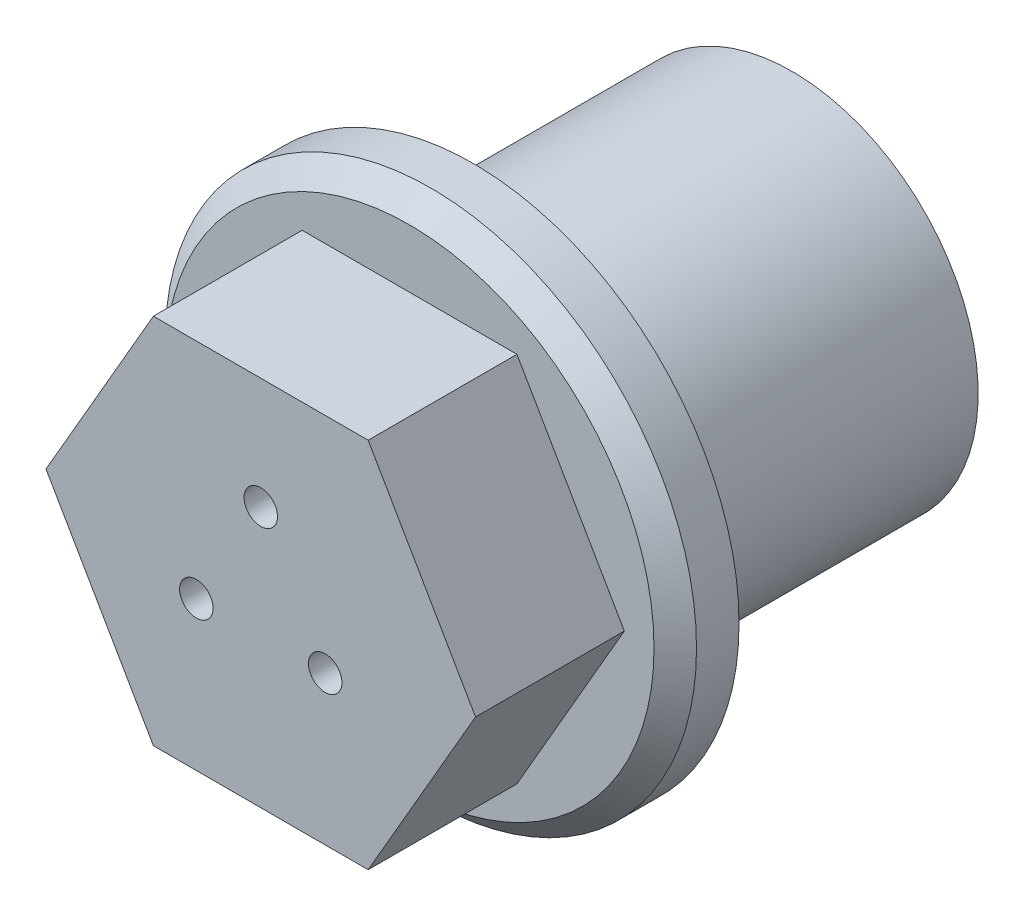
from build123d import *

# Parameters (mm, degrees)
SKETCH1_R           = 11.1125
BOSS_EXTRUDE1_DEPTH = 19.05
SKETCH2_R           = 15.875
BOSS_EXTRUDE2_DEPTH = 12.7
CUT_EXTRUDE1_START  = -8.89
SKETCH3_R           = 15.875
CUT_EXTRUDE1_DEPTH  = 8.89
CHAMFER1_SIZE       = 1.27
CUT_EXTRUDE2_REACH  = 40.886
SKETCH4_R           = 1


with BuildPart() as part:
    # Sketch1 → Boss-Extrude1 (new body)
    with BuildSketch(Plane.XY):
        with Locations(Location((0, 0, 0), (0, 0, 180))):
            Circle(SKETCH1_R)
    extrude(amount=BOSS_EXTRUDE1_DEPTH)

    # Sketch2 → Boss-Extrude2 (add)
    with BuildSketch(Plane.XY.offset(19.05)):
        Circle(SKETCH2_R)
    extrude(amount=BOSS_EXTRUDE2_DEPTH)

    # Sketch3 → Cut-Extrude1 (cut)
    with BuildSketch(Plane.XY.offset(31.75).offset(CUT_EXTRUDE1_START)):
        Circle(SKETCH3_R)
        Polygon((12.831609733, 0), (6.415804866, 11.1125), (-6.415804866, 11.1125), (-12.831609733, 0), (-6.415804866, -11.1125), (6.415804866, -11.1125), align=None, mode=Mode.SUBTRACT)
    extrude(amount=CUT_EXTRUDE1_DEPTH, mode=Mode.SUBTRACT)

    # Chamfer1
    chamfer1_edges = [part.edges().sort_by_distance(p)[0] for p in [
        (-15.875, 0, 22.86),
    ]]
    chamfer(chamfer1_edges, length=CHAMFER1_SIZE)

    # Cut-Loft1: read off the stored shape, not the designer's step
    # Cut-Loft1: loft between two sections, ruled curve by curve
    cut_loft1_from = [
        Edge.make_bspline([(2.35183174, 9.256296648, 0), (-16.160761555, 13.959960127, 0), (-20.864425035, -4.552633168, 0), (-2.35183174, -9.256296648, 0), (16.160761555, -13.959960127, 0), (20.864425035, 4.552633168, 0), (2.35183174, 9.256296648, 0)], [0, 0, 0, 0, 0.5, 0.5, 0.5, 1, 1, 1, 1], 3, [1, 0.333333333, 0.333333333, 1, 0.333333333, 0.333333333, 1]),
    ]
    cut_loft1_to = [
        Edge.make_bspline([(2.644109425, 4.759906548, 22.86), (-6.875703672, 10.048125398, 22.86), (-12.163922522, 0.528312301, 22.86), (-2.644109425, -4.759906548, 22.86), (6.875703672, -10.048125398, 22.86), (12.163922522, -0.528312301, 22.86), (2.644109425, 4.759906548, 22.86)], [0, 0, 0, 0, 0.5, 0.5, 0.5, 1, 1, 1, 1], 3, [1, 0.333333333, 0.333333333, 1, 0.333333333, 0.333333333, 1]),
    ]
    cut_loft1 = Solid(Shell([*[Face.make_surface_from_curves(cut_loft1_from[k], cut_loft1_to[k]) for k in range(1)], Face(Wire(cut_loft1_from)), Face(Wire(cut_loft1_to))]))
    add(cut_loft1, mode=Mode.SUBTRACT)

    # Sketch4 → Cut-Extrude2 (cut, up to next)
    with BuildSketch(Plane.XY.offset(31.75), mode=Mode.PRIVATE) as cut_extrude2_sk1:
        with Locations((0, 4.445)):
            Circle(SKETCH4_R)
    cut_extrude2_tool1 = extrude(cut_extrude2_sk1.sketch, amount=-CUT_EXTRUDE2_REACH, mode=Mode.PRIVATE) & part.part
    # Sketch4 → Cut-Extrude2 (cut, up to next)
    with BuildSketch(Plane.XY.offset(31.75), mode=Mode.PRIVATE) as cut_extrude2_sk2:
        with Locations((3.84948292, -2.2225)):
            Circle(SKETCH4_R)
    cut_extrude2_tool2 = extrude(cut_extrude2_sk2.sketch, amount=-CUT_EXTRUDE2_REACH, mode=Mode.PRIVATE) & part.part
    # Sketch4 → Cut-Extrude2 (cut, up to next)
    with BuildSketch(Plane.XY.offset(31.75), mode=Mode.PRIVATE) as cut_extrude2_sk3:
        with Locations((-3.84948292, -2.2225)):
            Circle(SKETCH4_R)
    cut_extrude2_tool3 = extrude(cut_extrude2_sk3.sketch, amount=-CUT_EXTRUDE2_REACH, mode=Mode.PRIVATE) & part.part
    add(cut_extrude2_tool1.solids().sort_by_distance((0, 4.445, 31.75))[0], mode=Mode.SUBTRACT)
    add(cut_extrude2_tool2.solids().sort_by_distance((3.849483, -2.2225, 31.75))[0], mode=Mode.SUBTRACT)
    add(cut_extrude2_tool3.solids().sort_by_distance((-3.849483, -2.2225, 31.75))[0], mode=Mode.SUBTRACT)


solid = part.part
